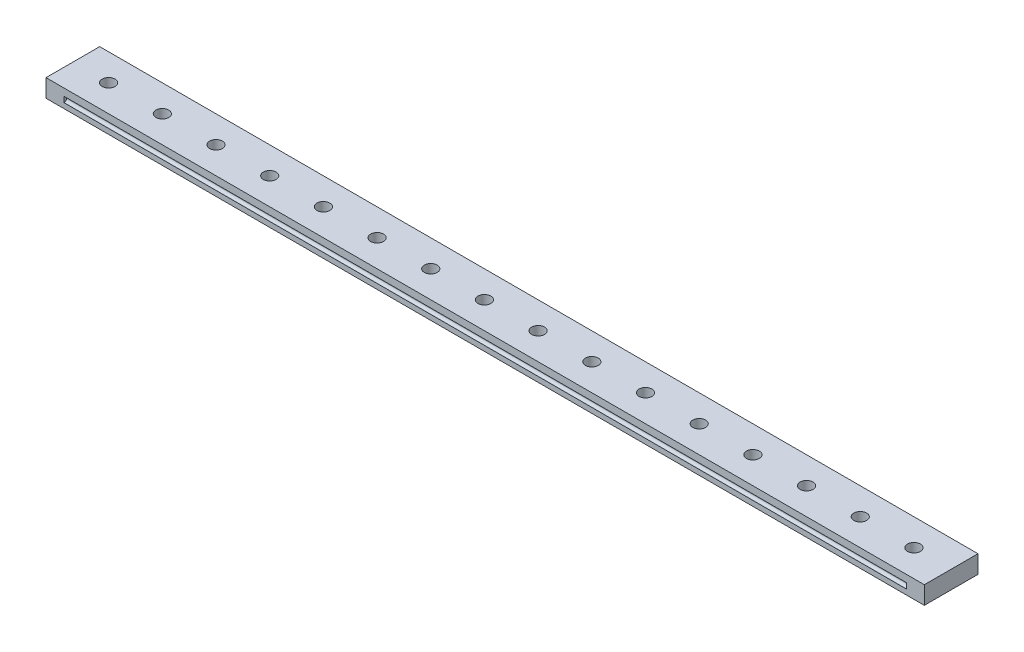
from build123d import *

# Parameters (mm, degrees)
SKETCH1_W          = 245.4
SKETCH1_H          = 5
MAIN_BODY_DEPTH    = 15
SKETCH3_R          = 1.8
CUT_EXTRUDE2_DEPTH = 5
SKETCH4_R          = 3
CUT_EXTRUDE3_DEPTH = 2
SKETCH2_W          = 235.4
SKETCH2_H          = 1.55
CHANNEL_A_DEPTH    = 0.75
CHANNEL_A_ROUND_R  = 0.7


with BuildPart() as part:
    # Sketch1 → Main_Body (new body)
    with BuildSketch(Plane.XY):
        with Locations((122.7, 2.5)):
            Rectangle(SKETCH1_W, SKETCH1_H)
    extrude(amount=MAIN_BODY_DEPTH)

    # Sketch3 → Cut-Extrude2 (cut)
    with BuildSketch(Plane.XZ):
        with Locations((10, 7.5)):
            Circle(SKETCH3_R)
        with Locations((25, 7.5)):
            Circle(SKETCH3_R)
        with Locations((40, 7.5)):
            Circle(SKETCH3_R)
        with Locations((55, 7.5)):
            Circle(SKETCH3_R)
        with Locations((70, 7.5)):
            Circle(SKETCH3_R)
        with Locations((85, 7.5)):
            Circle(SKETCH3_R)
        with Locations((100, 7.5)):
            Circle(SKETCH3_R)
        with Locations((115, 7.5)):
            Circle(SKETCH3_R)
        with Locations((130, 7.5)):
            Circle(SKETCH3_R)
        with Locations((145, 7.5)):
            Circle(SKETCH3_R)
        with Locations((160, 7.5)):
            Circle(SKETCH3_R)
        with Locations((175, 7.5)):
            Circle(SKETCH3_R)
        with Locations((190, 7.5)):
            Circle(SKETCH3_R)
        with Locations((205, 7.5)):
            Circle(SKETCH3_R)
        with Locations((220, 7.5)):
            Circle(SKETCH3_R)
        with Locations((235, 7.5)):
            Circle(SKETCH3_R)
    extrude(amount=-CUT_EXTRUDE2_DEPTH, mode=Mode.SUBTRACT)

    # Sketch4 → Cut-Extrude3 (cut)
    with BuildSketch(Plane.XZ):
        with Locations((10, 7.5)):
            Circle(SKETCH4_R)
        with Locations((25, 7.5)):
            Circle(SKETCH4_R)
        with Locations((40, 7.5)):
            Circle(SKETCH4_R)
        with Locations((55, 7.5)):
            Circle(SKETCH4_R)
        with Locations((70, 7.5)):
            Circle(SKETCH4_R)
        with Locations((85, 7.5)):
            Circle(SKETCH4_R)
        with Locations((100, 7.5)):
            Circle(SKETCH4_R)
        with Locations((115, 7.5)):
            Circle(SKETCH4_R)
        with Locations((130, 7.5)):
            Circle(SKETCH4_R)
        with Locations((145, 7.5)):
            Circle(SKETCH4_R)
        with Locations((160, 7.5)):
            Circle(SKETCH4_R)
        with Locations((175, 7.5)):
            Circle(SKETCH4_R)
        with Locations((190, 7.5)):
            Circle(SKETCH4_R)
        with Locations((205, 7.5)):
            Circle(SKETCH4_R)
        with Locations((220, 7.5)):
            Circle(SKETCH4_R)
        with Locations((235, 7.5)):
            Circle(SKETCH4_R)
    extrude(amount=-CUT_EXTRUDE3_DEPTH, mode=Mode.SUBTRACT)

    # Sketch2 → Channel_A (cut)
    with BuildSketch(Plane.XY.offset(15)):
        with Locations((122.7, 2.225)):
            Rectangle(SKETCH2_W, SKETCH2_H)
    extrude(amount=-CHANNEL_A_DEPTH, mode=Mode.SUBTRACT)

    # Channel_A_Round
    channel_a_round_edges = [part.edges().sort_by_distance(p)[0] for p in [
        (122.7, 1.45, 14.25),
        (122.7, 3, 14.25),
    ]]
    fillet(channel_a_round_edges, radius=CHANNEL_A_ROUND_R)


solid = part.part
